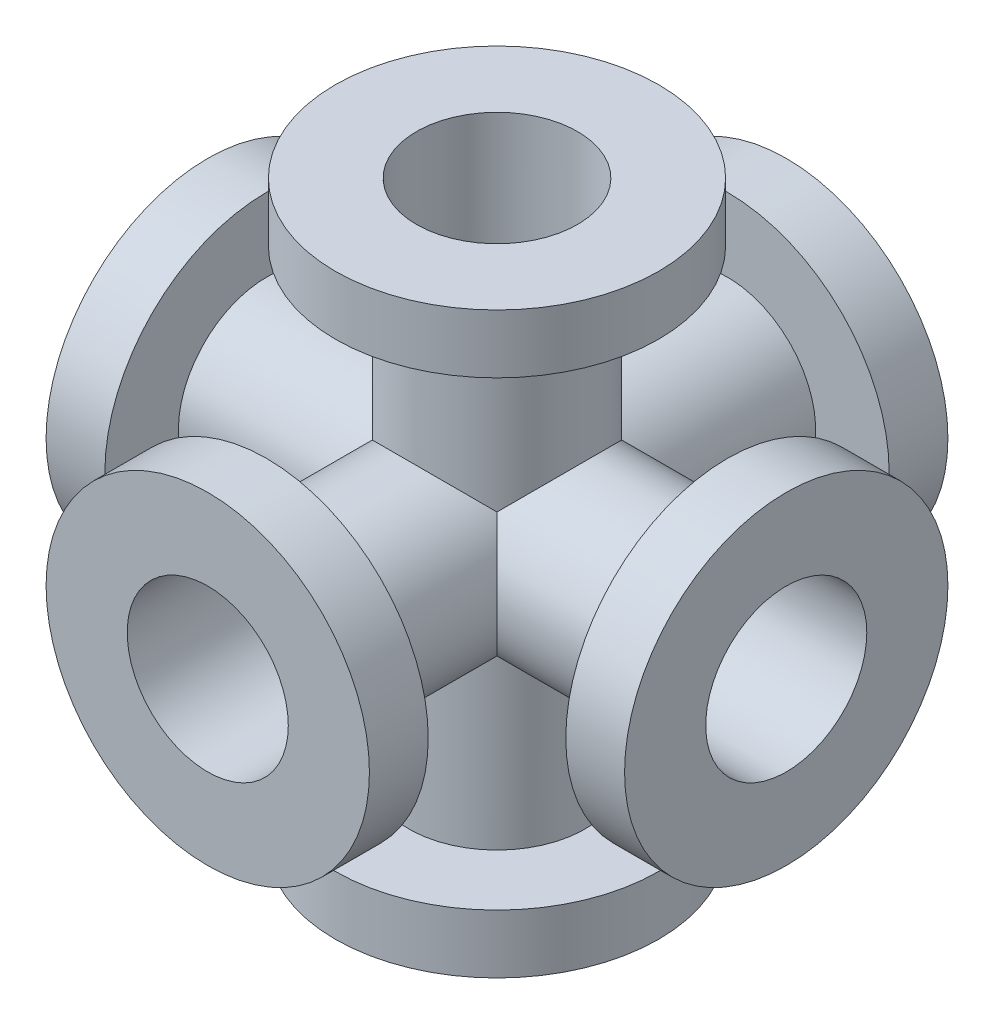
from build123d import *
from build123d.topology import SkipClean

# Parameters (mm, degrees)
EXTRUDE1_DEPTH      = 62.484
EXTRUDE1_DEPTH_BACK = 62.484
SKETCH1_R           = 19.05
SKETCH1_R_2         = 17.399
EXTRUDE2_DEPTH      = 62.484
EXTRUDE2_DEPTH_BACK = 62.484
SKETCH2_R           = 19.05
SKETCH2_R_2         = 17.399
EXTRUDE3_DEPTH      = 62.484
EXTRUDE3_DEPTH_BACK = 62.484
SKETCH3_R           = 19.05
SKETCH3_R_2         = 17.399
EXTRUDE4_START      = -81.534000101
EXTRUDE4_OUTLINE_R  = 17.399
EXTRUDE4_DEPTH      = 38.100000201
SKETCH5_R           = 17.399
EXTRUDE5_DEPTH      = 154.053917211
SKETCH6_R           = 17.399
EXTRUDE6_DEPTH      = 154.053917211
SKETCH7_R           = 34.925
SKETCH7_R_2         = 17.399
EXTRUDE7_DEPTH      = 12.7
SKETCH8_R           = 34.925
SKETCH8_R_2         = 17.399
EXTRUDE8_DEPTH      = 12.7
SKETCH9_R           = 34.925
SKETCH9_R_2         = 17.399
EXTRUDE9_DEPTH      = 12.7


# Read off the part's stored shape, not the designer's step: Extrude4
with BuildPart() as part:
    # Sketch1 → Extrude1 (new, two sides: drawn at the far end of the back side and taken through both)
    with BuildSketch(Plane(origin=(0, 0, 0), x_dir=(1, 0, 0), z_dir=(0, 1, 0)).offset(-EXTRUDE1_DEPTH_BACK)):
        with Locations(Location((0, 0, 0), (0, 0, 270))):
            Circle(SKETCH1_R)
        with Locations(Location((0, 0, 0), (0, 0, 270))):
            Circle(SKETCH1_R_2, mode=Mode.SUBTRACT)
    extrude(amount=EXTRUDE1_DEPTH + EXTRUDE1_DEPTH_BACK)

    # Sketch2 → Extrude2 (add, two sides: drawn at the far end of the back side and taken through both)
    with BuildSketch(Plane.XY.offset(-EXTRUDE2_DEPTH_BACK)):
        Circle(SKETCH2_R)
        Circle(SKETCH2_R_2, mode=Mode.SUBTRACT)
    extrude(amount=EXTRUDE2_DEPTH + EXTRUDE2_DEPTH_BACK)

    # Sketch3 → Extrude3 (add, two sides: drawn at the far end of the back side and taken through both)
    with BuildSketch(Plane(origin=(0, 0, 0), x_dir=(0, 0, -1), z_dir=(1, 0, 0)).offset(-EXTRUDE3_DEPTH_BACK)):
        Circle(SKETCH3_R)
        Circle(SKETCH3_R_2, mode=Mode.SUBTRACT)
    extrude(amount=EXTRUDE3_DEPTH + EXTRUDE3_DEPTH_BACK)

    # Extrude4 outline → Extrude4 (cut)
    with BuildSketch(Plane(origin=(62.484, 0, 0), x_dir=(0, 0, -1), z_dir=(1, 0, 0)).offset(EXTRUDE4_START)):
        Circle(EXTRUDE4_OUTLINE_R)
    extrude(amount=EXTRUDE4_DEPTH, mode=Mode.SUBTRACT)

    # Sketch5 → Extrude5 (cut, through all)
    with SkipClean():  # the faces are left unmerged after this step: merging them gives an invalid solid
        with BuildSketch(Plane(origin=(0, 0, -62.484), x_dir=(-1, 0, 0), z_dir=(0, 0, -1))):
            with Locations(Location((0, 0, 0), (0, 0, 180))):
                Circle(SKETCH5_R)
        extrude(amount=-EXTRUDE5_DEPTH, mode=Mode.SUBTRACT)

    # Sketch6 → Extrude6 (cut, through all)
    with BuildSketch(Plane(origin=(0, 62.484, 0), x_dir=(1, 0, 0), z_dir=(0, 1, 0))):
        with Locations(Location((0, 0, 0), (0, 0, 270))):
            Circle(SKETCH6_R)
    extrude(amount=-EXTRUDE6_DEPTH, mode=Mode.SUBTRACT)

    # Sketch7 → Extrude7 (add)
    with BuildSketch(Plane(origin=(62.484, 0, 0), x_dir=(0, 0, -1), z_dir=(1, 0, 0))):
        Circle(SKETCH7_R)
        Circle(SKETCH7_R_2, mode=Mode.SUBTRACT)
    extrude7 = extrude(amount=-EXTRUDE7_DEPTH)

    # Mirror1: Extrude7 across plane
    add(extrude7.mirror(Plane(origin=(0, 0, 0), x_dir=(0, 0, 1), z_dir=(1, 0, 0))))

    # Sketch8 → Extrude8 (add)
    with BuildSketch(Plane(origin=(0, 0, -62.484), x_dir=(-1, 0, 0), z_dir=(0, 0, -1))):
        Circle(SKETCH8_R)
        with Locations(Location((0, 0, 0), (0, 0, 180))):
            Circle(SKETCH8_R_2, mode=Mode.SUBTRACT)
    extrude8 = extrude(amount=-EXTRUDE8_DEPTH)

    # Mirror2: Extrude8 across plane
    add(extrude8.mirror(Plane.XY))

    # Sketch9 → Extrude9 (add)
    with BuildSketch(Plane(origin=(0, 62.484, 0), x_dir=(1, 0, 0), z_dir=(0, 1, 0))):
        with Locations(Location((0, 0, 0), (0, 0, 270))):
            Circle(SKETCH9_R)
        with Locations(Location((0, 0, 0), (0, 0, 270))):
            Circle(SKETCH9_R_2, mode=Mode.SUBTRACT)
    extrude9 = extrude(amount=-EXTRUDE9_DEPTH)

    # Mirror3: Extrude9 across plane
    add(extrude9.mirror(Plane.ZX))


solid = part.part
